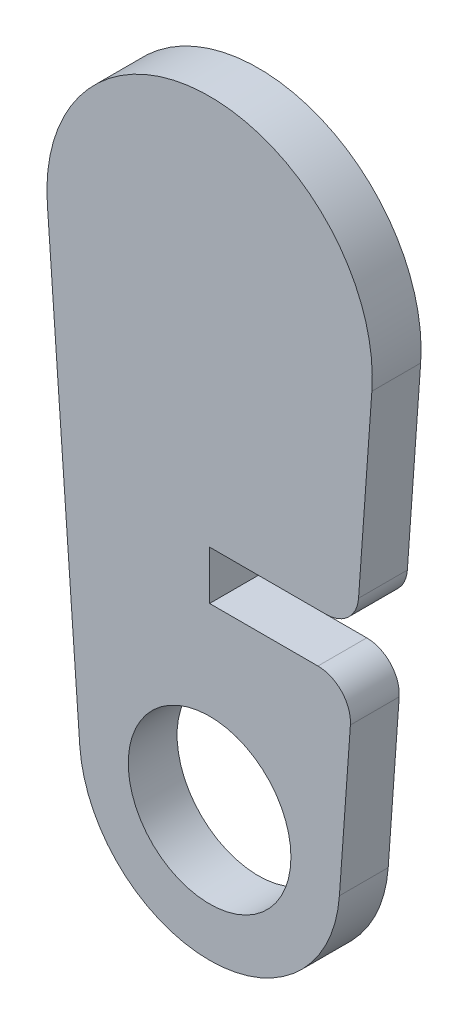
from build123d import *

# Parameters (mm, degrees)
ESQUISSE1_R        = 5
BOSS_EXTRU_1_DEPTH = 3
CONG_1_R           = 2


with BuildPart() as part:
    # Esquisse1 → Boss.-Extru.1 (new body)
    with BuildSketch(Plane.XY):
        with BuildLine():
            Line((9.023047413, 14), (0, 14))
            Line((0, 14), (0, 11))
            Line((0, 11), (8.808212951, 11))
            Line((8.808212951, 11), (7.979565739, -0.571428571))
            ThreePointArc((7.979565739, -0.571428571), (0, -8), (-7.979565739, -0.571428571))
            Line((-7.979565739, -0.571428571), (-9.974457174, 27.285714286))
            ThreePointArc((-9.974457174, 27.285714286), (0, 38), (9.974457174, 27.285714286))
            Line((9.974457174, 27.285714286), (9.023047413, 14))
        make_face()
        Circle(ESQUISSE1_R, mode=Mode.SUBTRACT)
    extrude(amount=BOSS_EXTRU_1_DEPTH)

    # Congé1
    cong_1_edges = [part.edges().sort_by_distance(p)[0] for p in [
        (8.808212951, 11, 1.5),
        (9.023047413, 14, 1.5),
    ]]
    fillet(cong_1_edges, radius=CONG_1_R)


solid = part.part
